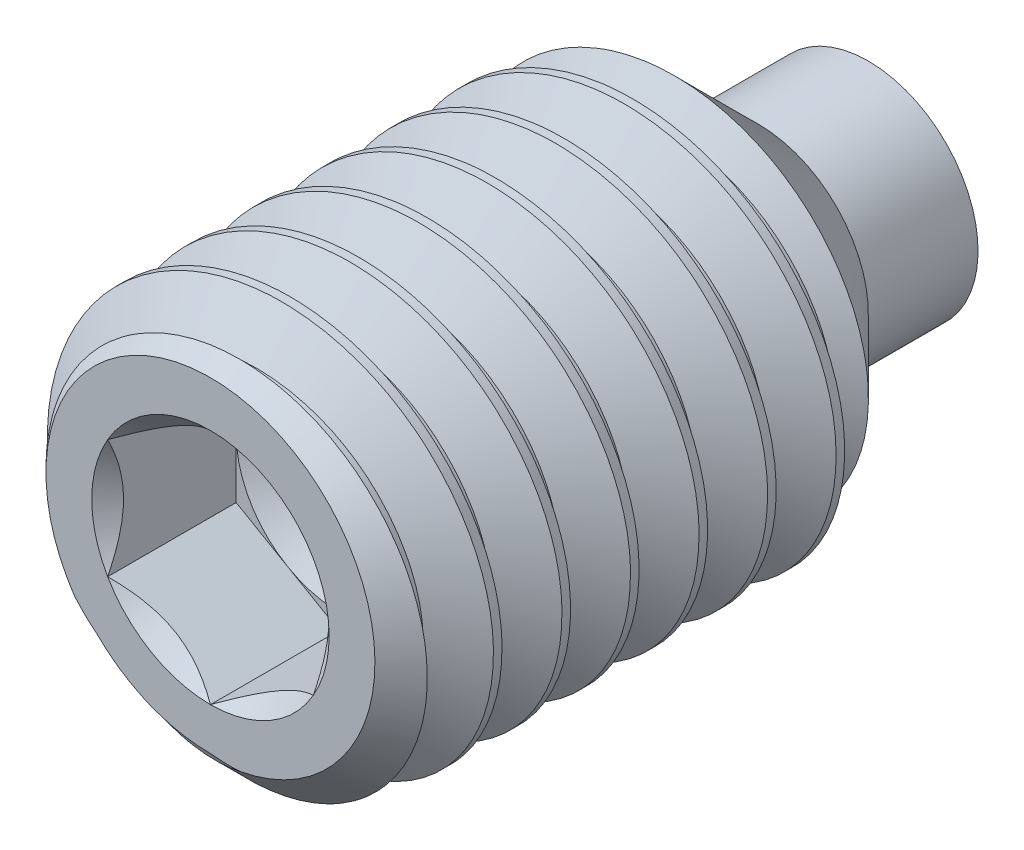
from build123d import *

# Parameters (mm, degrees)
CUT_SWEEP1_PITCH   = 1
CUT_EXTRUDE1_DEPTH = 1.875


with BuildPart() as part:
    # Sketch22 → Revolve1 (revolve)
    with BuildSketch(Plane(origin=(0, 0, 0), x_dir=(0, 0, -1), z_dir=(1, 0, 0))):
        Polygon((-4.8, 0), (-4.8, 2.4), (-4.2, 3), (1.8, 3), (3.2, 1.6), (4.8, 1.6), (4.8, 0), align=None)
    revolve(axis=Axis((0, 0, -4.8), (0, 0, 1)))

    # Cut-Sweep1: the profile of Sketch6 profile screwed along a right-hand helix of 9 turns, 8 arcs to a turn; built about Z, then put on its axis
    cut_sweep1_z = Axis((0, 0, 0), (0, 0, 1))
    cut_sweep1_corners = [(2.350480947, 0, -0.5), (2.350480947, 0, -0.375), (3.0003, 0, 0.000173205), (3.0003, 0, -0.875173205)]
    with BuildLine(mode=Mode.PRIVATE) as cut_sweep1_profile:
        Line(cut_sweep1_corners[0], cut_sweep1_corners[1])
        Line(cut_sweep1_corners[1], cut_sweep1_corners[2])
        Line(cut_sweep1_corners[2], cut_sweep1_corners[3])
        Line(cut_sweep1_corners[3], cut_sweep1_corners[0])
    cut_sweep1_cap = Face(cut_sweep1_profile.wire())
    cut_sweep1_turn_angles = [0, 22.5, 45, 67.5, 90, 112.5, 135, 157.5, 180, 202.5, 225, 247.5, 270, 292.5, 315, 337.5, 360]
    cut_sweep1_turn_weights = [1, 0.9238795325112867, 1, 0.9238795325112867, 1, 0.9238795325112867, 1, 0.9238795325112867, 1, 0.9238795325112867, 1, 0.9238795325112867, 1, 0.9238795325112867, 1, 0.9238795325112867, 1]
    cut_sweep1_turn_rails = [Edge.make_bspline([Vector(p[0], p[1], 0).rotate(cut_sweep1_z, cut_sweep1_turn_angles[k]) / cut_sweep1_turn_weights[k] + Vector(0, 0, p[2] + CUT_SWEEP1_PITCH * cut_sweep1_turn_angles[k] / 360) for k in range(17)], [0, 0, 0, 1, 1, 2, 2, 3, 3, 4, 4, 5, 5, 6, 6, 7, 7, 8, 8, 8], 2, cut_sweep1_turn_weights) for p in cut_sweep1_corners]
    cut_sweep1_turn_sides = [Face.make_surface_from_curves(cut_sweep1_turn_rails[p[0]], cut_sweep1_turn_rails[p[1]]) for p in [(0, 1), (1, 2), (2, 3), (3, 0)]]
    cut_sweep1 = Plane(origin=(0, 0, -3.2), x_dir=(0, 1, 0), z_dir=(0, 0, 1)) * Solid(Shell([*[p.moved(Location((0, 0, CUT_SWEEP1_PITCH * i))) for i in range(9) for p in cut_sweep1_turn_sides], cut_sweep1_cap, cut_sweep1_cap.rotate(cut_sweep1_z, 3240).moved(Location((0, 0, CUT_SWEEP1_PITCH * 3240 / 360)))]))
    add(cut_sweep1, mode=Mode.SUBTRACT)

    # Sketch30 → Cut-Extrude1 (cut)
    with BuildSketch(Plane.XY.offset(4.8)):
        Polygon((1.5, -0.866025404), (1.5, 0.866025404), (0, 1.732050808), (-1.5, 0.866025404), (-1.5, -0.866025404), (0, -1.732050808), align=None)
    extrude(amount=-CUT_EXTRUDE1_DEPTH, mode=Mode.SUBTRACT)

    # Cut-Extrude2 cone 1 section (through the dimple's axis) → Cut-Extrude2 (revolve, cut)
    with BuildSketch(Plane(origin=(0, 0, 4.8), x_dir=(0, -1, 0), z_dir=(1, 0, 0))):
        Polygon((0, 0), (1.732050808, 0), (0, 1.732050808), align=None)
    revolve(axis=Axis((0, 0, 4.8), (0, 0, -1)), mode=Mode.SUBTRACT)

    # Cut-Extrude3 cone 1 section (through the dimple's axis) → Cut-Extrude3 (revolve, cut)
    with BuildSketch(Plane(origin=(0, 0, 2.925), x_dir=(0, -1, 0), z_dir=(1, 0, 0))):
        Polygon((0, 0), (1.5, 0), (0, 0.866025404), align=None)
    revolve(axis=Axis((0, 0, 2.925), (0, 0, -1)), mode=Mode.SUBTRACT)


solid = part.part
